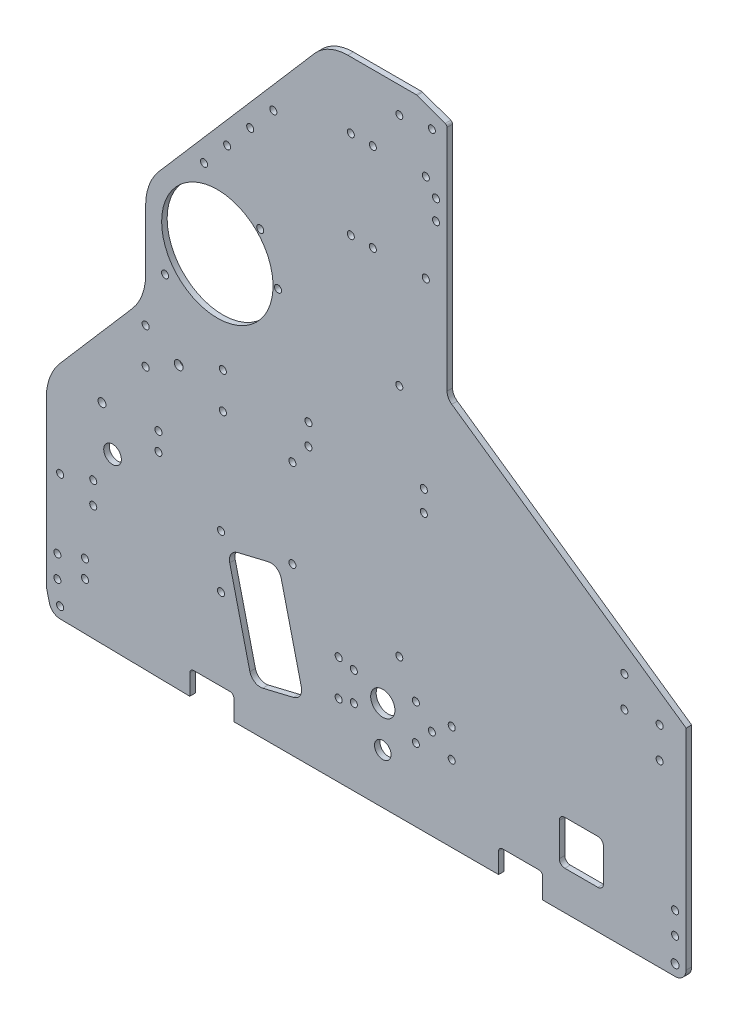
from build123d import *

# Parameters (mm, degrees)
SKETCH1_R           = 2.032
SKETCH1_R_2         = 5.08
SKETCH1_R_3         = 2.54
SKETCH1_R_4         = 2
BOSS_EXTRUDE1_DEPTH = 3.175
FILLET1_R           = 2.286
FILLET2_R           = 6.35
SKETCH2_R           = 2.032
CUT_EXTRUDE1_DEPTH  = 505.524983177
FILLET3_R           = 1.5875
SKETCH3_R           = 2.032
SKETCH3_R_2         = 2.286
CUT_EXTRUDE2_DEPTH  = 505.524983177
SKETCH4_R           = 2.032
SKETCH4_R_2         = 6.985
SKETCH4_R_3         = 4.7625
CUT_EXTRUDE3_DEPTH  = 505.524983177
SKETCH5_R           = 32.0675
SKETCH5_R_2         = 2.286000001
CUT_EXTRUDE5_DEPTH  = 505.524983177
FILLET4_R           = 31.75
CUT_EXTRUDE6_DEPTH  = 505.524983177
FILLET5_R           = 25.4
SKETCH8_R           = 2.031999999
SKETCH8_R_2         = 2.032
CUT_EXTRUDE7_DEPTH  = 505.524983177
SKETCH10_R          = 2.031999999
CUT_EXTRUDE8_DEPTH  = 505.524983177
FILLET6_R           = 6.35
SKETCH11_RX         = 2.032
SKETCH11_RY         = 2.031999502
CUT_EXTRUDE9_DEPTH  = 505.524983177


with BuildPart() as part:
    # Sketch1 → Boss-Extrude1 (new body)
    with BuildSketch(Plane.XY):
        with BuildLine():
            Line((7.829508682, -19.049081656), (82.55, -20.32))
            Line((82.55, -20.32), (82.55, -6.35))
            Line((82.55, -6.35), (107.95, -6.35))
            Line((107.95, -6.35), (107.95, -20.32))
            Line((107.95, -20.32), (260.35, -20.32))
            Line((260.35, -20.32), (260.35, -6.35))
            Line((260.35, -6.35), (285.75, -6.35))
            Line((285.75, -6.35), (285.75, -20.32))
            Line((285.75, -20.32), (368.3, -20.32))
            Line((368.3, -20.32), (368.3, 106.68))
            Line((368.3, 106.68), (230.66375, 202.565))
            Line((230.66375, 202.565), (230.66375, 338.455))
            Line((230.66375, 338.455), (213.19998, 344.805))
            Line((213.19998, 344.805), (203.2, 344.805))
            Line((203.2, 344.805), (161.925, 344.805))
            Line((161.925, 344.805), (52.720122664, 218.469945827))
            ThreePointArc((52.720122664, 218.469945827), (52.803835479, 218.142145922), (52.832, 217.805))
            ThreePointArc((52.832, 217.805), (52.095493096, 216.239521914), (50.419872403, 215.808871996))
            Line((50.419872403, 215.808871996), (0, 157.48))
            Line((0, 157.48), (0, 0))
            Line((0, 0), (0, -6.35))
            ThreePointArc((0, -6.35), (0.047577015, -7.125863724), (0.189595124, -7.890101219))
            Line((0.189595124, -7.890101219), (1.777095124, -14.240101219))
            ThreePointArc((1.777095124, -14.240101219), (3.987212552, -17.671692778), (7.829508682, -19.049081656))
        make_face()
        with Locations((7.9375, -12.7)):
            Circle(SKETCH1_R, mode=Mode.SUBTRACT)
        with Locations((6.35, 0)):
            Circle(SKETCH1_R, mode=Mode.SUBTRACT)
        with Locations((6.35, 12.7)):
            Circle(SKETCH1_R, mode=Mode.SUBTRACT)
        with Locations((38.1, 78.105)):
            Circle(SKETCH1_R_2, mode=Mode.SUBTRACT)
        with Locations((57.15, 131.28625)):
            Circle(SKETCH1_R, mode=Mode.SUBTRACT)
        with Locations((57.15, 151.92375)):
            Circle(SKETCH1_R, mode=Mode.SUBTRACT)
        with Locations((76.2, 141.605)):
            Circle(SKETCH1_R_3, mode=Mode.SUBTRACT)
        with Locations((101.6, 131.28625)):
            Circle(SKETCH1_R, mode=Mode.SUBTRACT)
        with Locations((101.6, 151.92375)):
            Circle(SKETCH1_R, mode=Mode.SUBTRACT)
        with Locations((203.2, 59.805)):
            Circle(SKETCH1_R_4, mode=Mode.SUBTRACT)
        with Locations((361.95, 0)):
            Circle(SKETCH1_R, mode=Mode.SUBTRACT)
        with Locations((361.95, 12.7)):
            Circle(SKETCH1_R, mode=Mode.SUBTRACT)
        with Locations((353.06, 82.955052336)):
            Circle(SKETCH1_R, mode=Mode.SUBTRACT)
        with Locations((332.74, 98.195052336)):
            Circle(SKETCH1_R, mode=Mode.SUBTRACT)
        with Locations((332.74, 115.975052336)):
            Circle(SKETCH1_R, mode=Mode.SUBTRACT)
        with Locations((353.06, 100.735052336)):
            Circle(SKETCH1_R, mode=Mode.SUBTRACT)
        with Locations((68.326, 182.923674932)):
            Circle(SKETCH1_R, mode=Mode.SUBTRACT)
        with Locations((76.2, 217.805)):
            Circle(SKETCH1_R, mode=Mode.SUBTRACT)
        with Locations((90.779500502, 249.682)):
            Circle(SKETCH1_R, mode=Mode.SUBTRACT)
        with Locations((104.067838673, 265.054783374)):
            Circle(SKETCH1_R, mode=Mode.SUBTRACT)
        with Locations((117.356176844, 280.427566748)):
            Circle(SKETCH1_R, mode=Mode.SUBTRACT)
        with Locations((130.644515014, 295.800350122)):
            Circle(SKETCH1_R, mode=Mode.SUBTRACT)
        with Locations((203.2, 194.805)):
            Circle(SKETCH1_R_4, mode=Mode.SUBTRACT)
        with Locations((224.31375, 287.401)):
            Circle(SKETCH1_R, mode=Mode.SUBTRACT)
        with Locations((224.31375, 298.831)):
            Circle(SKETCH1_R, mode=Mode.SUBTRACT)
        with Locations((203.2, 329.805)):
            Circle(SKETCH1_R_4, mode=Mode.SUBTRACT)
        with Locations((221.931865, 332.105)):
            Circle(SKETCH1_R_4, mode=Mode.SUBTRACT)
    extrude(amount=BOSS_EXTRUDE1_DEPTH)

    # Fillet1
    fillet1_edges = [part.edges().sort_by_distance(p)[0] for p in [
        (285.75, -6.35, 1.5875),
        (107.95, -6.35, 1.5875),
        (260.35, -6.35, 1.5875),
        (82.55, -6.35, 1.5875),
    ]]
    fillet(fillet1_edges, radius=FILLET1_R)

    # Fillet2
    fillet2_edges = [part.edges().sort_by_distance(p)[0] for p in [
        (230.66375, 202.565, 1.5875),
    ]]
    fillet(fillet2_edges, radius=FILLET2_R)

    # Sketch2 → Cut-Extrude1 (cut, through all)
    with BuildSketch(Plane(origin=(0, 0, 0), x_dir=(-1, 0, 0), z_dir=(0, 0, -1))):
        with Locations((-100.552770272, 71.086035298)):
            Circle(SKETCH2_R)
        with Locations((-100.552770272, 40.606035298)):
            Circle(SKETCH2_R)
        with Locations((-22.225, 18.202541089)):
            Circle(SKETCH2_R)
        with Locations((-22.225, 8.042541089)):
            Circle(SKETCH2_R)
    extrude(amount=-CUT_EXTRUDE1_DEPTH, mode=Mode.SUBTRACT)

    # Fillet3
    fillet3_edges = [part.edges().sort_by_distance(p)[0] for p in [
        (230.66375, 338.455, 1.5875),
        (213.19998, 344.805, 1.5875),
    ]]
    fillet(fillet3_edges, radius=FILLET3_R)

    # Sketch3 → Cut-Extrude2 (cut, through all)
    with BuildSketch(Plane.XY.offset(3.175)):
        with BuildLine():
            Line((127.789350211, 69.359774106), (110.09075034, 65.117184968))
            ThreePointArc((110.09075034, 65.117184968), (106.287939856, 62.356288953), (105.55119507, 57.715047577))
            Line((105.55119507, 57.715047577), (117.160037875, 9.287010566))
            ThreePointArc((117.160037875, 9.287010566), (119.920933891, 5.484200083), (124.562175266, 4.747455297))
            Line((124.562175266, 4.747455297), (142.260775137, 8.990044434))
            ThreePointArc((142.260775137, 8.990044434), (146.063585621, 11.75094045), (146.800330407, 16.392181825))
            Line((146.800330407, 16.392181825), (135.191487602, 64.820218836))
            ThreePointArc((135.191487602, 64.820218836), (132.430591586, 68.62302932), (127.789350211, 69.359774106))
        make_face()
        with Locations((26.987500002, 46.953113935)):
            Circle(SKETCH3_R)
        with Locations((26.987500002, 59.653113935)):
            Circle(SKETCH3_R)
        with Locations((7.937500002, 53.303113935)):
            Circle(SKETCH3_R)
        with Locations((32.030600738, 100.810868776)):
            Circle(SKETCH3_R_2)
        with Locations((64.525942114, 102.94048958)):
            Circle(SKETCH3_R)
        with Locations((64.525942114, 92.525786339)):
            Circle(SKETCH3_R)
        with Locations((133.35, 208.228121768)):
            Circle(SKETCH3_R)
        with Locations((123.120704333, 232.923826101)):
            Circle(SKETCH3_R)
    extrude(amount=-CUT_EXTRUDE2_DEPTH, mode=Mode.SUBTRACT)

    # Sketch4 → Cut-Extrude3 (cut, through all)
    with BuildSketch(Plane.XY.offset(3.175)):
        with Locations((168.275, 42.06875)):
            Circle(SKETCH4_R)
        with Locations((212.725, 42.06875)):
            Circle(SKETCH4_R)
        with Locations((212.725, 21.43125)):
            Circle(SKETCH4_R)
        with Locations((168.275, 21.43125)):
            Circle(SKETCH4_R)
        with Locations((193.675, 31.75)):
            Circle(SKETCH4_R_2)
        with Locations((177.00498, 40.0431)):
            Circle(SKETCH4_R)
        with Locations((177.00498, 23.4569)):
            Circle(SKETCH4_R)
        with Locations((193.675, 8.466666658)):
            Circle(SKETCH4_R_3)
        with Locations((221.931865, 31.75)):
            Circle(SKETCH4_R)
        with Locations((233.36123, 23.4569)):
            Circle(SKETCH4_R)
        with Locations((233.36123, 40.0431)):
            Circle(SKETCH4_R)
    extrude(amount=-CUT_EXTRUDE3_DEPTH, mode=Mode.SUBTRACT)

    # Sketch5 → Cut-Extrude5 (cut, through all)
    with BuildSketch(Plane(origin=(0, 0, 0), x_dir=(-1, 0, 0), z_dir=(0, 0, -1))):
        Polygon((0, 157.48), (-57.15, 223.594705882), (-57.15, 165.333696112), (0, 99.218990229), align=None)
        with Locations((-98.425, 208.228121768)):
            Circle(SKETCH5_R)
        with Locations((-361.95, -13.97)):
            Circle(SKETCH5_R_2)
    extrude(amount=-CUT_EXTRUDE5_DEPTH, mode=Mode.SUBTRACT)

    # Fillet4
    fillet4_edges = [part.edges().sort_by_distance(p)[0] for p in [
        (0, 99.218990229, 1.5875),
        (57.15, 165.333696112, 1.5875),
        (57.15, 223.594705882, 1.5875),
    ]]
    fillet(fillet4_edges, radius=FILLET4_R)

    # Sketch6 → Cut-Extrude6 (cut, through all)
    with BuildSketch(Plane.XY.offset(3.175)):
        with BuildLine():
            Line((298.45, 27.305), (317.5, 27.305))
            ThreePointArc((317.5, 27.305), (319.74506403, 26.37506403), (320.675, 24.13))
            Line((320.675, 24.13), (320.675, 5.08))
            ThreePointArc((320.675, 5.08), (319.74506403, 2.83493597), (317.5, 1.905))
            Line((317.5, 1.905), (298.45, 1.905))
            ThreePointArc((298.45, 1.905), (296.20493597, 2.83493597), (295.275, 5.08))
            Line((295.275, 5.08), (295.275, 24.13))
            ThreePointArc((295.275, 24.13), (296.20493597, 26.37506403), (298.45, 27.305))
        make_face()
    extrude(amount=-CUT_EXTRUDE6_DEPTH, mode=Mode.SUBTRACT)

    # Fillet5
    fillet5_edges = [part.edges().sort_by_distance(p)[0] for p in [
        (161.925, 344.805, 1.5875),
    ]]
    fillet(fillet5_edges, radius=FILLET5_R)

    # Sketch8 → Cut-Extrude7 (cut, through all)
    with BuildSketch(Plane(origin=(0, 0, 0), x_dir=(-1, 0, 0), z_dir=(0, 0, -1))):
        with Locations((-187.96, 306.70500001)):
            Circle(SKETCH8_R)
        with Locations((-175.26, 306.70500001)):
            Circle(SKETCH8_R_2)
        with Locations((-218.44, 306.704999997)):
            Circle(SKETCH8_R_2)
        with Locations((-218.44, 255.904999997)):
            Circle(SKETCH8_R_2)
        with Locations((-187.96, 255.90500001)):
            Circle(SKETCH8_R)
        with Locations((-175.26, 255.90500001)):
            Circle(SKETCH8_R_2)
    extrude(amount=-CUT_EXTRUDE7_DEPTH, mode=Mode.SUBTRACT)

    # Sketch10 → Cut-Extrude8 (cut, through all)
    with BuildSketch(Plane.XY.offset(3.175)):
        with Locations((141.642480002, 75.160621768)):
            Circle(SKETCH10_R)
        with Locations((141.642480002, 125.960621768)):
            Circle(SKETCH10_R)
    extrude(amount=-CUT_EXTRUDE8_DEPTH, mode=Mode.SUBTRACT)

    # Fillet6
    fillet6_edges = [part.edges().sort_by_distance(p)[0] for p in [
        (368.3, -20.32, 1.5875),
    ]]
    fillet(fillet6_edges, radius=FILLET6_R)

    # Sketch11 → Cut-Extrude9 (cut, through all)
    with BuildSketch(Plane.XY.offset(3.175)):
        with Locations(Location((150.881424454, 138.43), (0, 0, 90))):
            Ellipse(SKETCH11_RX, SKETCH11_RY)
        with Locations(Location((150.881424454, 150.495), (0, 0, 90))):
            Ellipse(SKETCH11_RX, SKETCH11_RY)
        with Locations(Location((217.30240818, 150.495), (0, 0, 90))):
            Ellipse(SKETCH11_RX, SKETCH11_RY)
        with Locations(Location((217.30240818, 138.43), (0, 0, 90))):
            Ellipse(SKETCH11_RX, SKETCH11_RY)
    extrude(amount=-CUT_EXTRUDE9_DEPTH, mode=Mode.SUBTRACT)


solid = part.part
